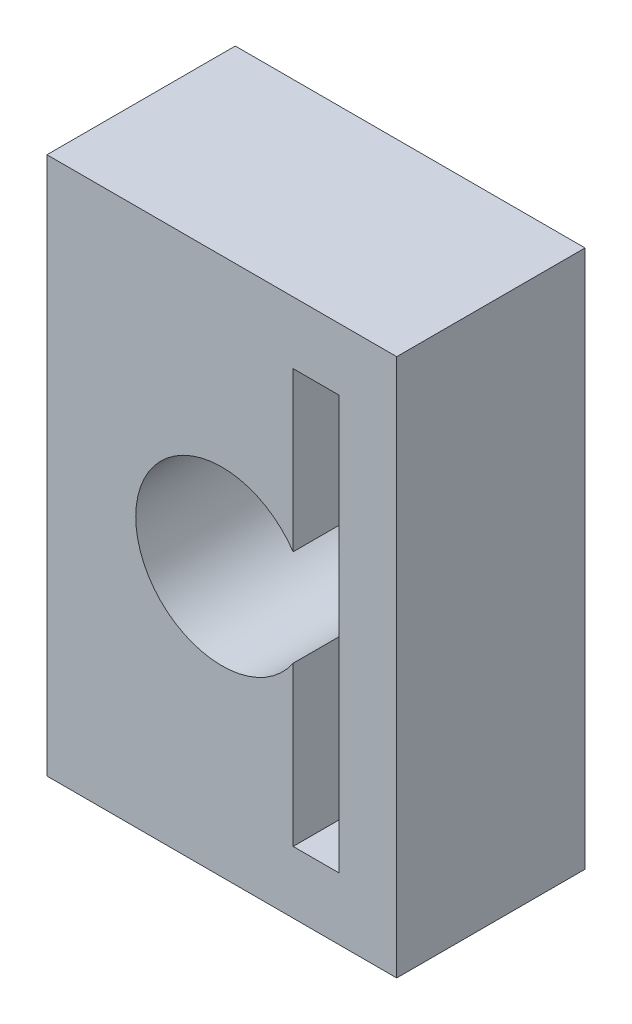
from build123d import *

# Parameters (mm, degrees)
SKETCH2_W           = 13
SKETCH2_H           = 20
BOSS_EXTRUDE1_DEPTH = 6
BOSS_EXTRUDE2_DEPTH = 2
BOSS_EXTRUDE3_START = 1
SKETCH3_W           = 13
SKETCH3_H           = 20
SKETCH3_R           = 3.2
BOSS_EXTRUDE3_DEPTH = 1
BOSS_EXTRUDE4_DEPTH = 4
CUT_EXTRUDE1_START  = -6
CUT_EXTRUDE1_DEPTH  = 6
BOSS_EXTRUDE5_DEPTH = 2


# Read off the part's stored shape, not the designer's step: Cut-Extrude1
with BuildPart() as part:
    # Sketch2 → Boss-Extrude1 (new body)
    with BuildSketch(Plane.XY):
        Rectangle(SKETCH2_W, SKETCH2_H)
        with BuildLine():
            Line((1.3, -9.04), (1.3, -2.924038303))
            ThreePointArc((1.3, -2.924038303), (-3.2, 0), (1.3, 2.924038303))
            Line((1.3, 2.924038303), (1.3, 9.04))
            Line((1.3, 9.04), (5.7, 9.04))
            Line((5.7, 9.04), (5.7, -9.04))
            Line((5.7, -9.04), (1.3, -9.04))
        make_face(mode=Mode.SUBTRACT)
    extrude(amount=BOSS_EXTRUDE1_DEPTH)

    # Sketch2<3> → Boss-Extrude2 (add)
    with BuildSketch(Plane.XY):
        with BuildLine():
            Line((4.2, 7.54), (4.2, -7.54))
            Line((4.2, -7.54), (2.8, -7.54))
            Line((2.8, -7.54), (2.8, -1.549193338))
            ThreePointArc((2.8, -1.549193338), (2.162186317, -2.359014695), (1.3, -2.924038303))
            Line((1.3, -2.924038303), (1.3, -9.04))
            Line((1.3, -9.04), (5.7, -9.04))
            Line((5.7, -9.04), (5.7, 9.04))
            Line((5.7, 9.04), (1.3, 9.04))
            Line((1.3, 9.04), (1.3, 2.924038303))
            ThreePointArc((1.3, 2.924038303), (2.162186317, 2.359014695), (2.8, 1.549193338))
            Line((2.8, 1.549193338), (2.8, 7.54))
            Line((2.8, 7.54), (4.2, 7.54))
        make_face()
    extrude(amount=BOSS_EXTRUDE2_DEPTH)

    # Sketch3 → Boss-Extrude3 (add)
    with BuildSketch(Plane(origin=(0, 0, 0), x_dir=(-1, 0, 0), z_dir=(0, 0, -1)).offset(BOSS_EXTRUDE3_START)):
        Rectangle(SKETCH3_W, SKETCH3_H)
        Circle(SKETCH3_R, mode=Mode.SUBTRACT)
    extrude(amount=-BOSS_EXTRUDE3_DEPTH)

    # Sketch4 → Boss-Extrude4 (add)
    with BuildSketch(Plane.XY.offset(2)):
        with BuildLine():
            Line((2.8, 1.549193338), (2.8, 7.54))
            Line((2.8, 7.54), (4.2, 7.54))
            Line((4.2, 7.54), (4.2, -7.54))
            Line((4.2, -7.54), (2.8, -7.54))
            Line((2.8, -7.54), (2.8, -1.549193338))
            ThreePointArc((2.8, -1.549193338), (2.162186317, -2.359014695), (1.3, -2.924038303))
            Line((1.3, -2.924038303), (1.3, -9.04))
            Line((1.3, -9.04), (5.7, -9.04))
            Line((5.7, -9.04), (5.7, 9.04))
            Line((5.7, 9.04), (1.3, 9.04))
            Line((1.3, 9.04), (1.3, 2.924038303))
            ThreePointArc((1.3, 2.924038303), (2.162186317, 2.359014695), (2.8, 1.549193338))
        make_face()
    extrude(amount=BOSS_EXTRUDE4_DEPTH)

    # Cut-Extrude1 outline → Cut-Extrude1 (cut)
    with BuildSketch(Plane.XY.offset(6).offset(CUT_EXTRUDE1_START)):
        with BuildLine():
            Line((4.35, 7.69), (2.65, 7.69))
            Line((2.65, 7.69), (2.65, 1.793739111))
            ThreePointArc((2.65, 1.793739111), (2.727741861, 1.673148033), (2.8, 1.549193338))
            Line((2.8, 1.549193338), (2.8, 7.54))
            Line((2.8, 7.54), (4.2, 7.54))
            Line((4.2, 7.54), (4.2, -7.54))
            Line((4.2, -7.54), (2.8, -7.54))
            Line((2.8, -7.54), (2.8, -1.549193338))
            ThreePointArc((2.8, -1.549193338), (2.727741861, -1.673148033), (2.65, -1.793739111))
            Line((2.65, -1.793739111), (2.65, -7.69))
            Line((2.65, -7.69), (4.35, -7.69))
            Line((4.35, -7.69), (4.35, 7.69))
        make_face()
    extrude(amount=CUT_EXTRUDE1_DEPTH, mode=Mode.SUBTRACT)

    # Sketch7 → Boss-Extrude5 (add)
    with BuildSketch(Plane.XY):
        with BuildLine():
            Line((2.65, 7.69), (2.65, 1.793739111))
            ThreePointArc((2.65, 1.793739111), (3.2, 0), (2.65, -1.793739111))
            Line((2.65, -1.793739111), (2.65, -7.69))
            Line((2.65, -7.69), (4.35, -7.69))
            Line((4.35, -7.69), (4.35, 7.69))
            Line((4.35, 7.69), (2.65, 7.69))
        make_face()
    extrude(amount=BOSS_EXTRUDE5_DEPTH)


solid = part.part
